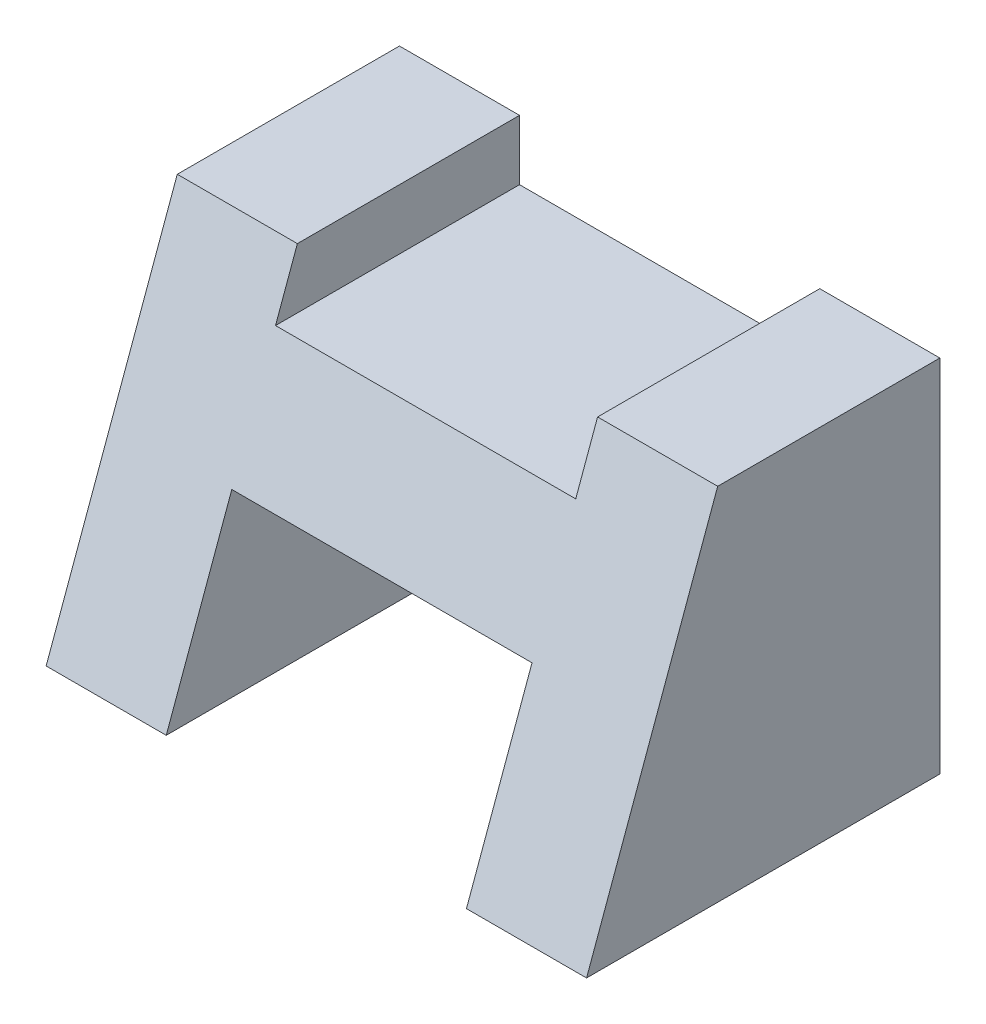
from build123d import *

# Parameters (mm, degrees)
SZKIC1_W                      = 2
SZKIC1_H                      = 6
DODANIE_WYCI_GNI_CIE1_DEPTH   = 6
DODANIE_WYCI_GNI_CIE1_2_DEPTH = 6
SZKIC3_W                      = 6
SZKIC3_H                      = 3
DODANIE_WYCI_GNI_CIE2_DEPTH   = 5
SFAZOWANIE2_SIZE              = 6.319198065
SFAZOWANIE2_SIZE_2            = 2.3
SZKIC5_W                      = 5
SZKIC5_H                      = 3.7
SZKIC5_H_2                    = 1.091910703
WYTNIJ_WYCI_GNI_CIE1_DEPTH    = 1


with BuildPart() as part:
    # Szkic1 → Dodanie-wyciągnięcie1 (new body)
    with BuildSketch(Plane.XY):
        with Locations((1, 3)):
            Rectangle(SZKIC1_W, SZKIC1_H)
    extrude(amount=DODANIE_WYCI_GNI_CIE1_DEPTH)



with BuildPart() as body_2:
    # Szkic1 → Dodanie-wyci_gni_cie1 2 (new body)
    with BuildSketch(Plane.XY):
        with Locations((8, 3)):
            Rectangle(SZKIC1_W, SZKIC1_H)
    extrude(amount=DODANIE_WYCI_GNI_CIE1_2_DEPTH)


with BuildPart() as part_1:
    add(part.part)

    add(body_2.part)  # Dodanie-wyciągnięcie2 merges body 2
    # Szkic3 → Dodanie-wyciągnięcie2 (add)
    with BuildSketch(Plane(origin=(2, 0, 0), x_dir=(0, 0, -1), z_dir=(1, 0, 0))):
        with Locations((-3, 4.5)):
            Rectangle(SZKIC3_W, SZKIC3_H)
    extrude(amount=DODANIE_WYCI_GNI_CIE2_DEPTH)

    # Sfazowanie2
    # the kernel refuses this chamfer: 6.319198065, 2.3 mm, written as the material it takes off along each edge
    with BuildSketch(Plane(origin=(-16.393230334, 6, 6), x_dir=(0, -0.9999130865277316, 0.013184058198645751), z_dir=(1, 0, 0))) as sfazowanie2_piece_1:
        Polygon((SFAZOWANIE2_SIZE * 0.999913086487, SFAZOWANIE2_SIZE * 0.0131840581981), (-SFAZOWANIE2_SIZE_2 * 0.0131840581986, SFAZOWANIE2_SIZE_2 * 0.999913086528), (0, 0), align=None)
    extrude(amount=41.786460667, mode=Mode.SUBTRACT)

    # Szkic5 → Wytnij-wyciągnięcie1 (cut)
    with BuildSketch(Plane(origin=(0, 6, 0), x_dir=(1, 0, 0), z_dir=(0, 1, 0))):
        with Locations((4.5, -1.85)):
            Rectangle(SZKIC5_W, SZKIC5_H)
        with Locations((4.5, -4.245955352)):
            Rectangle(SZKIC5_W, SZKIC5_H_2)
    extrude(amount=-WYTNIJ_WYCI_GNI_CIE1_DEPTH, mode=Mode.SUBTRACT)


solid = part_1.part
